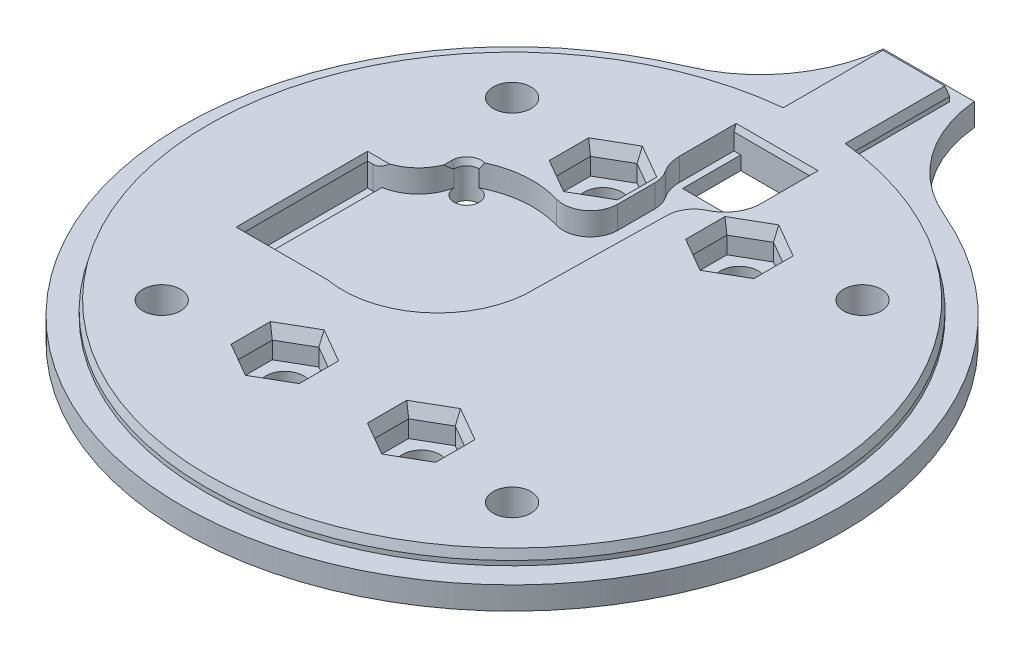
from build123d import *
from OCP.BRepFilletAPI import BRepFilletAPI_MakeChamfer

# Parameters (mm, degrees)
SKETCH_1_R               = 72.5
EXTRUDE_1_DEPTH          = 5
SKETCH_2_R               = 67.35
EXTRUDE_2_DEPTH          = 3
SKETCH_3_W               = 50
SKETCH_3_H               = 50
EXTRUDE_3_DEPTH          = 25
SKETCH_5_R               = 4.15
CUT_EXTRUDE_2_DEPTH      = 106.534354596
SKETCH_6_R               = 2.75
CUT_EXTRUDE_3_DEPTH      = 108.710259493
SKETCH2_W                = 20.25
SKETCH2_H                = 10.35
CUT_EXTRUDE1_DEPTH       = 125.046362301
CHAMFER1_SIZE            = 2
CHAMFER1_SIZE2           = 0.535898385
SKETCH4_W                = 50
SKETCH4_H                = 50
CUT_EXTRUDE3_DEPTH       = 12.5
BOSS_EXTRUDE2_START      = -2
SKETCH5_W                = 50
SKETCH5_H                = 90
BOSS_EXTRUDE2_DEPTH      = 5.325
SKETCH6_R                = 4.15
CUT_EXTRUDE4_DEPTH       = 104.392725203
CUT_EXTRUDE5_DEPTH       = 6.5
CHAMFER2_SIZE            = 1
CHAMFER2_SIZE2           = 2.747477419
SKETCH8_W                = 17.5
SKETCH8_H                = 27.9
CUT_EXTRUDE6_DEPTH       = 5
CHAMFER3_SIZE            = 10
CHAMFER6_SIZE            = 3
CHAMFER6_SIZE2           = 5.795554958
CUT_EXTRUDE8_DEPTH       = 5
CHAMFER7_SIZE            = 0.5
CHAMFER7_SIZE2           = 1.37373871
SKETCH11_W               = 3
SKETCH11_H               = 27.9
CUT_EXTRUDE9_DEPTH       = 1.5
CHAMFER8_SIZE            = 1
SKETCH12_W               = 5.356236397
SKETCH12_H               = 35
BOSS_EXTRUDE3_DEPTH      = 5
SKETCH13_W               = 20
SKETCH13_H               = 40
BOSS_EXTRUDE5_DEPTH      = 5
FILLET2_R                = 30
BOSS_EXTRUDE6_START      = -3
SKETCH14_W               = 14.7
SKETCH14_H               = 22.5
BOSS_EXTRUDE6_DEPTH      = 3
CHAMFER9_SIZE            = 2
CHAMFER9_SIZE2           = 0.535898385
CUT_EXTRUDE11_DEPTH      = 118.890014844
CUT_EXTRUDE11_DEPTH_BACK = 118.890014844
SKETCH16_W               = 15
SKETCH16_H               = 12.8
CUT_EXTRUDE12_DEPTH      = 5
CUT_EXTRUDE13_DEPTH      = 5
FILLET4_R                = 6
CHAMFER10_SIZE           = 0.5
CHAMFER10_SIZE2          = 1.37373871
BOSS_EXTRUDE8_DEPTH      = 1
FILLET5_R                = 10


with BuildPart() as part:
    # Эскиз1 → Бобышка-Вытянуть1 (new body)
    with BuildSketch(Plane(origin=(0, 0, 0), x_dir=(1, 0, 0), z_dir=(0, 1, 0))):
        with Locations(Location((0, 0, 0), (0, 0, 270))):
            Circle(SKETCH_1_R)
    extrude(amount=EXTRUDE_1_DEPTH)

    # Эскиз2 → Бобышка-Вытянуть2 (add)
    with BuildSketch(Plane(origin=(0, 5, 0), x_dir=(1, 0, 0), z_dir=(0, 1, 0))):
        with Locations(Location((0, 0, 0), (0, 0, 270))):
            Circle(SKETCH_2_R)
    extrude(amount=EXTRUDE_2_DEPTH)

    # Эскиз3 → Бобышка-Вытянуть3 (add)
    with BuildSketch(Plane.XZ):
        Rectangle(SKETCH_3_W, SKETCH_3_H)
    extrude(amount=EXTRUDE_3_DEPTH)

    # Эскиз5 → Вырез-Вытянуть2 (cut, through all)
    with BuildSketch(Plane.XZ):
        with Locations(Location((38.537319575, -38.537319575, 0), (0, 0, 270))):
            Circle(SKETCH_5_R)
        with Locations(Location((-38.537319575, -38.537319575, 0), (0, 0, 270))):
            Circle(SKETCH_5_R)
        with Locations(Location((-38.537319575, 38.537319575, 0), (0, 0, 270))):
            Circle(SKETCH_5_R)
        with Locations(Location((38.537319575, 38.537319575, 0), (0, 0, 270))):
            Circle(SKETCH_5_R)
    extrude(amount=-CUT_EXTRUDE_2_DEPTH, mode=Mode.SUBTRACT)

    # Эскиз6 → Вырез-Вытянуть3 (cut, through all)
    with BuildSketch(Plane(origin=(0, 8, 0), x_dir=(1, 0, 0), z_dir=(0, 1, 0))):
        with Locations(Location((-30, 20, 0), (0, 0, 270))):
            Circle(SKETCH_6_R)
    extrude(amount=-CUT_EXTRUDE_3_DEPTH, mode=Mode.SUBTRACT)

    # Sketch2 → Cut-Extrude1 (cut, through all)
    with BuildSketch(Plane.ZY.offset(25)):
        with Locations((0, -12.5)):
            Rectangle(SKETCH2_W, SKETCH2_H)
    extrude(amount=-CUT_EXTRUDE1_DEPTH, mode=Mode.SUBTRACT)

    # Chamfer1
    chamfer1_edges = [part.edges().sort_by_distance(p)[0] for p in [
        (0, 8, -67.35),
    ]]
    chamfer1_side = [part.faces().sort_by_distance(p)[0] for p in [
        (0, 6.5, -67.35),
    ]]
    chamfer(chamfer1_edges, length=CHAMFER1_SIZE, length2=CHAMFER1_SIZE2, reference=chamfer1_side[0])

    # Sketch4 → Cut-Extrude3 (cut)
    with BuildSketch(Plane.XZ.offset(25)):
        Rectangle(SKETCH4_W, SKETCH4_H)
    extrude(amount=-CUT_EXTRUDE3_DEPTH, mode=Mode.SUBTRACT)

    # Sketch5 → Boss-Extrude2 (add)
    with BuildSketch(Plane.XZ.offset(7.325).offset(BOSS_EXTRUDE2_START)):
        Rectangle(SKETCH5_W, SKETCH5_H)
    extrude(amount=-BOSS_EXTRUDE2_DEPTH)

    # Sketch6 → Cut-Extrude4 (cut, through all)
    with BuildSketch(Plane.XZ.offset(5.325)):
        with Locations(Location((-15, 35, 0), (0, 0, 270))):
            Circle(SKETCH6_R)
        with Locations(Location((-15, -35, 0), (0, 0, 270))):
            Circle(SKETCH6_R)
        with Locations(Location((15, 35, 0), (0, 0, 270))):
            Circle(SKETCH6_R)
        with Locations(Location((15, -35, 0), (0, 0, 270))):
            Circle(SKETCH6_R)
    extrude(amount=-CUT_EXTRUDE4_DEPTH, mode=Mode.SUBTRACT)

    # Sketch7 → Cut-Extrude5 (cut)
    with BuildSketch(Plane(origin=(0, 8, 0), x_dir=(1, 0, 0), z_dir=(0, 1, 0))):
        Polygon((-15, -42.5), (-8.504809472, -38.75), (-8.504809472, -31.25), (-15, -27.5), (-21.495190528, -31.25), (-21.495190528, -38.75), align=None)
        Polygon((-15, 27.5), (-8.504809472, 31.25), (-8.504809472, 38.75), (-15, 42.5), (-21.495190528, 38.75), (-21.495190528, 31.25), align=None)
        Polygon((15, -42.5), (21.495190528, -38.75), (21.495190528, -31.25), (15, -27.5), (8.504809472, -31.25), (8.504809472, -38.75), align=None)
        Polygon((15, 27.5), (21.495190528, 31.25), (21.495190528, 38.75), (15, 42.5), (8.504809472, 38.75), (8.504809472, 31.25), align=None)
    extrude(amount=-CUT_EXTRUDE5_DEPTH, mode=Mode.SUBTRACT)

    # Chamfer2
    chamfer2_edges = [part.edges().sort_by_distance(p)[0] for p in [
        (-18.247595264, 8, 40.625),
        (-11.752404736, 8, 40.625),
        (-8.504809472, 8, 35),
        (-11.752404736, 8, 29.375),
        (-18.247595264, 8, 29.375),
        (-21.495190528, 8, 35),
        (-18.247595264, 8, -29.375),
        (-11.752404736, 8, -29.375),
        (-8.504809472, 8, -35),
        (-11.752404736, 8, -40.625),
        (-18.247595264, 8, -40.625),
        (-21.495190528, 8, -35),
        (11.752404736, 8, 40.625),
        (18.247595264, 8, 40.625),
        (21.495190528, 8, 35),
        (18.247595264, 8, 29.375),
        (11.752404736, 8, 29.375),
        (8.504809472, 8, 35),
        (11.752404736, 8, -29.375),
        (18.247595264, 8, -29.375),
        (21.495190528, 8, -35),
        (18.247595264, 8, -40.625),
        (11.752404736, 8, -40.625),
        (8.504809472, 8, -35),
    ]]
    chamfer2_side = [part.faces().sort_by_distance(p)[0] for p in [
        (0.05399731, 8, 0.035998207),
    ]]
    chamfer(chamfer2_edges, length=CHAMFER2_SIZE, length2=CHAMFER2_SIZE2, reference=chamfer2_side[0])

    # Sketch8 → Cut-Extrude6 (cut)
    with BuildSketch(Plane(origin=(0, 8, 0), x_dir=(1, 0, 0), z_dir=(0, 1, 0))):
        with Locations((-35, -2)):
            Rectangle(SKETCH8_W, SKETCH8_H)
    extrude(amount=-CUT_EXTRUDE6_DEPTH, mode=Mode.SUBTRACT)

    # Chamfer3
    chamfer3_edges = [part.edges().sort_by_distance(p)[0] for p in [
        (25, -2.6625, -45),
        (-25, -2.6625, 45),
        (25, -2.6625, 45),
        (-25, -2.6625, -45),
    ]]
    chamfer(chamfer3_edges, length=CHAMFER3_SIZE)

    # Chamfer6: one chamfer whose edges measure the first distance from different faces: ONE call of the kernel's chamfer builder (chamfer() names one face for all edges)
    chamfer6_edges_1 = [part.edges().sort_by_distance(p)[0] for p in [
        (25, -2.6625, -35),
    ]]
    chamfer6_side_1 = [part.faces().sort_by_distance(p)[0] for p in [
        (20, -2.6625, -40),
    ]]
    chamfer6_edges_2 = [part.edges().sort_by_distance(p)[0] for p in [
        (25, -2.6625, 35),
    ]]
    chamfer6_side_2 = [part.faces().sort_by_distance(p)[0] for p in [
        (20, -2.6625, 40),
    ]]
    chamfer6_edges_3 = [part.edges().sort_by_distance(p)[0] for p in [
        (-25, -2.6625, 35),
    ]]
    chamfer6_side_3 = [part.faces().sort_by_distance(p)[0] for p in [
        (-20, -2.6625, 40),
    ]]
    chamfer6_edges_4 = [part.edges().sort_by_distance(p)[0] for p in [
        (-25, -2.6625, -35),
    ]]
    chamfer6_side_4 = [part.faces().sort_by_distance(p)[0] for p in [
        (-20, -2.6625, -40),
    ]]
    chamfer6 = BRepFilletAPI_MakeChamfer(part.part.solid().wrapped)
    for e in chamfer6_edges_1:
        chamfer6.Add(CHAMFER6_SIZE, CHAMFER6_SIZE2, e.wrapped, chamfer6_side_1[0].wrapped)  # the first distance lies on this face
    for e in chamfer6_edges_2:
        chamfer6.Add(CHAMFER6_SIZE, CHAMFER6_SIZE2, e.wrapped, chamfer6_side_2[0].wrapped)  # the first distance lies on this face
    for e in chamfer6_edges_3:
        chamfer6.Add(CHAMFER6_SIZE, CHAMFER6_SIZE2, e.wrapped, chamfer6_side_3[0].wrapped)  # the first distance lies on this face
    for e in chamfer6_edges_4:
        chamfer6.Add(CHAMFER6_SIZE, CHAMFER6_SIZE2, e.wrapped, chamfer6_side_4[0].wrapped)  # the first distance lies on this face
    add(Compound.cast(chamfer6.Shape()), mode=Mode.REPLACE)

    # Sketch10 → Cut-Extrude8 (cut)
    with BuildSketch(Plane(origin=(0, 8, 0), x_dir=(1, 0, 0), z_dir=(0, 1, 0))):
        with BuildLine():
            Line((-32.75, 20), (-32.75, 11.95))
            Line((-32.75, 11.95), (-26.25, 11.95))
            Line((-26.25, 11.95), (-26.25, -15.95))
            ThreePointArc((-26.25, -15.95), (0.316727959, 6.155981391), (-30, 22.75))
            ThreePointArc((-30, 22.75), (-31.944543648, 21.944543648), (-32.75, 20))
        make_face()
    extrude(amount=-CUT_EXTRUDE8_DEPTH, mode=Mode.SUBTRACT)

    # Chamfer7
    chamfer7_edges = [part.edges().sort_by_distance(p)[0] for p in [
        (-43.75, 8, 2),
        (-35, 8, 15.95),
        (-38.25, 8, -11.95),
        (-32.75, 8, -15.975),
        (-31.944543648, 8, -21.944543648),
    ]]
    chamfer7_side = [part.faces().sort_by_distance(p)[0] for p in [
        (2.833522961, 8, 0.355265211),
    ]]
    chamfer(chamfer7_edges, length=CHAMFER7_SIZE, length2=CHAMFER7_SIZE2, reference=chamfer7_side[0])

    # Sketch11 → Cut-Extrude9 (cut)
    with BuildSketch(Plane(origin=(0, 3, 0), x_dir=(1, 0, 0), z_dir=(0, 1, 0))):
        with Locations((-42.25, -2)):
            Rectangle(SKETCH11_W, SKETCH11_H)
    extrude(amount=-CUT_EXTRUDE9_DEPTH, mode=Mode.SUBTRACT)

    # Chamfer8
    chamfer8_edges = [part.edges().sort_by_distance(p)[0] for p in [
        (0, -12.5, 10.125),
        (0, -12.5, -10.125),
    ]]
    chamfer(chamfer8_edges, length=CHAMFER8_SIZE)

    # Sketch12 → Boss-Extrude3 (add)
    with BuildSketch(Plane.XZ):
        with Locations((-67.678118199, 0)):
            Rectangle(SKETCH12_W, SKETCH12_H)
    extrude(amount=-BOSS_EXTRUDE3_DEPTH)

    # Sketch13 → Boss-Extrude5 (add)
    with BuildSketch(Plane.XZ):
        with Locations((0, -71.66)):
            Rectangle(SKETCH13_W, SKETCH13_H)
    extrude(amount=-BOSS_EXTRUDE5_DEPTH)

    # Fillet2
    # the kernel refuses this fillet: 30 mm, written as the material it adds along each edge
    with BuildSketch(Plane(origin=(-10, 5, -71.807033082), x_dir=(0, 0, -1), z_dir=(0, -1, 0))) as fillet2_piece_1:
        with BuildLine():
            CenterArc((22.619997266, -29.872119829), FILLET2_R, 95.292160412, 61.815779483)
            Line((-5.017182348, -18.202231098), (-5.56992594, -17.968833324))
            ThreePointArc((-5.56992594, -17.968833324), (-2.491940672, -9.10570502), (-0.594265101, 0.082758621))
            Line((-0.594265101, 0.082758621), (0, 0.6))
            ThreePointArc((0, 0.6), (9.926483459, 0.6), (19.797626311, 0.597442397))
            Line((19.797626311, 0.597442397), (19.852966918, 0))
        make_face()
    extrude(amount=5)
    with BuildSketch(Plane(origin=(10, 5, -71.807033082), x_dir=(0, 0, -1), z_dir=(0, -1, 0))) as fillet2_piece_2:
        with BuildLine():
            CenterArc((22.619997266, 29.872119829), FILLET2_R, 202.892060105, 61.815779483)
            Line((-5.017182348, 18.202231098), (-5.56992594, 17.968833324))
            ThreePointArc((-5.56992594, 17.968833324), (-2.491940672, 9.10570502), (-0.594265101, -0.082758621))
            Line((-0.594265101, -0.082758621), (0, -0.6))
            ThreePointArc((0, -0.6), (9.926483459, -0.6), (19.797626311, -0.597442397))
            Line((19.797626311, -0.597442397), (19.852966918, 0))
        make_face()
    extrude(amount=5)

    # Sketch14 → Boss-Extrude6 (add)
    with BuildSketch(Plane(origin=(0, 8, 0), x_dir=(1, 0, 0), z_dir=(0, 1, 0)).offset(BOSS_EXTRUDE6_START)):
        with Locations((0, 77.658596391)):
            Rectangle(SKETCH14_W, SKETCH14_H)
    extrude(amount=BOSS_EXTRUDE6_DEPTH)

    # Chamfer9: one chamfer whose edges measure the first distance from different faces: ONE call of the kernel's chamfer builder (chamfer() names one face for all edges)
    chamfer9_edges_1 = [part.edges().sort_by_distance(p)[0] for p in [
        (-7.35, 8, -77.658596391),
    ]]
    chamfer9_side_1 = [part.faces().sort_by_distance(p)[0] for p in [
        (-7.35, 6.506764094, -77.837583292),
    ]]
    chamfer9_edges_2 = [part.edges().sort_by_distance(p)[0] for p in [
        (0, 8, -88.908596391),
    ]]
    chamfer9_side_2 = [part.faces().sort_by_distance(p)[0] for p in [
        (0, 6.5, -88.908596391),
    ]]
    chamfer9_edges_3 = [part.edges().sort_by_distance(p)[0] for p in [
        (7.35, 8, -77.658596391),
    ]]
    chamfer9_side_3 = [part.faces().sort_by_distance(p)[0] for p in [
        (7.35, 6.506764094, -77.837583292),
    ]]
    chamfer9 = BRepFilletAPI_MakeChamfer(part.part.solid().wrapped)
    for e in chamfer9_edges_1:
        chamfer9.Add(CHAMFER9_SIZE, CHAMFER9_SIZE2, e.wrapped, chamfer9_side_1[0].wrapped)  # the first distance lies on this face
    for e in chamfer9_edges_2:
        chamfer9.Add(CHAMFER9_SIZE, CHAMFER9_SIZE2, e.wrapped, chamfer9_side_2[0].wrapped)  # the first distance lies on this face
    for e in chamfer9_edges_3:
        chamfer9.Add(CHAMFER9_SIZE, CHAMFER9_SIZE2, e.wrapped, chamfer9_side_3[0].wrapped)  # the first distance lies on this face
    add(Compound.cast(chamfer9.Shape()), mode=Mode.REPLACE)

    # Sketch16 → Cut-Extrude11 (cut, two sides: drawn at the far end of the back side and taken through both)
    with BuildSketch(Plane(origin=(0, 3, 0), x_dir=(1, 0, 0), z_dir=(0, 1, 0)).offset(-CUT_EXTRUDE11_DEPTH_BACK)):
        with Locations((0, 51.4)):
            Rectangle(SKETCH16_W, SKETCH16_H)
    extrude(amount=CUT_EXTRUDE11_DEPTH + CUT_EXTRUDE11_DEPTH_BACK, mode=Mode.SUBTRACT)

    # Sketch19 → Cut-Extrude12 (cut)
    with BuildSketch(Plane(origin=(0, 8, 0), x_dir=(1, 0, 0), z_dir=(0, 1, 0))):
        with BuildLine():
            Line((-1, 37.8), (1, 37.8))
            ThreePointArc((1, 37.8), (6.656854249, 40.143145751), (9, 45.8))
            Line((9, 45.8), (9, 57.8))
            Line((9, 57.8), (-9, 57.8))
            Line((-9, 57.8), (-9, 45.8))
            ThreePointArc((-9, 45.8), (-6.656854249, 40.143145751), (-1, 37.8))
        make_face()
    extrude(amount=-CUT_EXTRUDE12_DEPTH, mode=Mode.SUBTRACT)

    # Sketch20 → Cut-Extrude13 (cut)
    with BuildSketch(Plane(origin=(0, 8, 0), x_dir=(1, 0, 0), z_dir=(0, 1, 0))):
        with BuildLine():
            Line((1, 37.8), (0.344510352, 2.435242953))
            Line((0.344510352, 2.435242953), (-6.656854249, 19.811083442))
            Line((-6.656854249, 19.811083442), (-6.656854249, 40.143145751))
            ThreePointArc((-6.656854249, 40.143145751), (-4.061467459, 38.40896374), (-1, 37.8))
            Line((-1, 37.8), (1, 37.8))
        make_face()
    extrude(amount=-CUT_EXTRUDE13_DEPTH, mode=Mode.SUBTRACT)

    # Fillet4
    fillet4_edges = [part.edges().sort_by_distance(p)[0] for p in [
        (1, 5.5, -37.8),
        (-6.656854249, 5.5, -40.143145751),
        (-6.656854249, 5.5, -19.811083442),
    ]]
    fillet(fillet4_edges, radius=FILLET4_R)

    # Chamfer10
    chamfer10_edges = [part.edges().sort_by_distance(p)[0] for p in [
        (0, 8, -57.8),
    ]]
    chamfer10_side = [part.faces().sort_by_distance(p)[0] for p in [
        (3.079405642, 8, 0.226505842),
    ]]
    chamfer(chamfer10_edges, length=CHAMFER10_SIZE, length2=CHAMFER10_SIZE2, reference=chamfer10_side[0])

    # Sketch21 → Boss-Extrude8 (add)
    # profile 1 of 4: a face of its own
    with BuildSketch(Plane.XZ):
        Polygon((-12.512820513, -76.708839129), (-12.512820513, -68.708839129), (-7.692307692, -68.708839129), (-7.692307692, -70.042172462), (-11.179487179, -70.042172462), (-11.179487179, -71.990890411), (-8.102564103, -71.990890411), (-8.102564103, -73.324223744), (-11.179487179, -73.324223744), (-11.179487179, -76.708839129), align=None)
    # profile 2 of 4: a face of its own
    with BuildSketch(Plane.XZ):
        Polygon((-4.923076923, -76.708839129), (-4.923076923, -70.042172462), (-6.974358974, -70.042172462), (-6.974358974, -68.708839129), (-1.538461538, -68.708839129), (-1.538461538, -70.042172462), (-3.58974359, -70.042172462), (-3.58974359, -76.708839129), align=None)
    # profile 3 of 4: a face of its own
    with BuildSketch(Plane.XZ):
        with BuildLine():
            Line((4.102564103, -73.734480154), (5.435897436, -74.247300667))
            add(Edge.make_bspline(
                [(5.435897436, -74.247300667), (5.408074392, -74.348024588), (5.353755481, -74.544667831), (5.25684294, -74.828358281), (5.142232503, -75.090341897), (5.018406045, -75.334433006), (4.877534172, -75.555576438), (4.727264768, -75.760193346), (4.560220368, -75.942187916), (4.381251214, -76.105458575), (4.190178325, -76.249160829), (3.984678294, -76.370870373), (3.76791254, -76.476018879), (3.537718535, -76.559936175), (3.296520878, -76.628785424), (3.041898976, -76.673491901), (2.775835309, -76.703727939), (2.594105563, -76.707115044), (2.501602564, -76.708839129)],
                knots=[0, 0, 0, 0, 1.198775336, 2.340368289, 3.435616053, 4.477217326, 5.477015256, 6.440443256, 7.386164735, 8.305912611, 9.216631866, 10.123693807, 11.041970346, 11.976625703, 12.931280842, 13.915784304, 14.939104867, 16, 16, 16, 16], degree=3))
            add(Edge.make_bspline(
                [(2.501602564, -76.708839129), (2.386531309, -76.706235104), (2.161060395, -76.701132772), (1.830941817, -76.646880432), (1.516365503, -76.564757279), (1.21634082, -76.448492937), (0.933783164, -76.297136996), (0.666926154, -76.111753508), (0.41457155, -75.895228272), (0.181437656, -75.644913899), (-0.030350938, -75.366199072), (-0.214600897, -75.06084225), (-0.370863125, -74.731071138), (-0.498963432, -74.377473323), (-0.598266801, -73.998740372), (-0.667661004, -73.596093227), (-0.709854522, -73.169141577), (-0.715202226, -72.876673906), (-0.717948718, -72.726467334)],
                knots=[0, 0, 0, 0, 0.959362395, 1.879777157, 2.783637912, 3.668494084, 4.557863058, 5.451788729, 6.374725563, 7.327093754, 8.300589743, 9.290528948, 10.297382912, 11.340817566, 12.42413264, 13.559982916, 14.746847464, 16, 16, 16, 16], degree=3))
            add(Edge.make_bspline(
                [(-0.717948718, -72.726467334), (-0.715148897, -72.56826137), (-0.709690431, -72.259826736), (-0.668290084, -71.810899986), (-0.597613547, -71.388931272), (-0.501443123, -70.993761698), (-0.374207592, -70.626488786), (-0.220225986, -70.2857034), (-0.037531891, -69.972246116), (0.172773964, -69.68754476), (0.40721535, -69.434681206), (0.658678605, -69.212105801), (0.928959356, -69.023926624), (1.217533816, -68.871065934), (1.524136379, -68.751910208), (1.848201465, -68.666705607), (2.190220162, -68.616746106), (2.423980416, -68.609813012), (2.543269231, -68.606275026)],
                knots=[0, 0, 0, 0, 1.28229292, 2.499928197, 3.650293311, 4.747750281, 5.792589881, 6.796353809, 7.774422504, 8.727923098, 9.659441741, 10.564550584, 11.445003982, 12.322481659, 13.205391236, 14.105483459, 15.033220446, 16, 16, 16, 16], degree=3))
            add(Edge.make_bspline(
                [(2.543269231, -68.606275026), (2.647551643, -68.60922609), (2.85156175, -68.614999324), (3.150399367, -68.654941874), (3.433437506, -68.724835919), (3.70305449, -68.818330081), (3.95628746, -68.943334455), (4.194529076, -69.095108854), (4.419443923, -69.272749177), (4.552800786, -69.411272598), (4.620192308, -69.481275026)],
                knots=[0, 0, 0, 0, 1.077018231, 2.106995795, 3.106601534, 4.083801927, 5.048587746, 6.015925872, 6.997353628, 8, 8, 8, 8], degree=3))
            add(Edge.make_bspline(
                [(4.620192308, -69.481275026), (4.659512671, -69.525997207), (4.739578825, -69.617062821), (4.845633579, -69.7692612), (4.947501149, -69.932807434), (5.040703423, -70.111734641), (5.124434954, -70.305727572), (5.20319985, -70.51243124), (5.274480937, -70.733197871), (5.313357147, -70.886484467), (5.333333333, -70.965249385)],
                knots=[0, 0, 0, 0, 0.858519553, 1.748161818, 2.672126799, 3.637341794, 4.655416187, 5.718917618, 6.827886643, 8, 8, 8, 8], degree=3))
            Line((5.333333333, -70.965249385), (4, -71.272941693))
            add(Edge.make_bspline(
                [(4, -71.272941693), (3.988536097, -71.222505705), (3.965983505, -71.123284498), (3.918602017, -70.980643808), (3.864661453, -70.84596457), (3.801658923, -70.719008114), (3.728330141, -70.601193203), (3.645317845, -70.491608123), (3.556423801, -70.38817811), (3.456606656, -70.295934253), (3.350576496, -70.212233291), (3.23905584, -70.138311575), (3.120774625, -70.076774651), (2.996883672, -70.02788269), (2.868794878, -69.986495933), (2.73421692, -69.960582628), (2.594575785, -69.941286986), (2.499003886, -69.940174864), (2.450320513, -69.939608359)],
                knots=[0, 0, 0, 0, 1.113413563, 2.190385138, 3.233007624, 4.236357095, 5.238848635, 6.216809649, 7.195244301, 8.172054095, 9.138783586, 10.102495896, 11.049371996, 12.00439147, 12.968721699, 13.943496612, 14.952437649, 16, 16, 16, 16], degree=3))
            add(Edge.make_bspline(
                [(2.450320513, -69.939608359), (2.38394839, -69.941222592), (2.253149041, -69.944403755), (2.062640513, -69.97641251), (1.880607683, -70.02399195), (1.708344189, -70.092622109), (1.547558299, -70.184642405), (1.393459928, -70.291122974), (1.252737939, -70.422101553), (1.117907912, -70.568657445), (0.999229839, -70.740970638), (0.894313134, -70.935574002), (0.808880432, -71.156283555), (0.736604083, -71.399418611), (0.68346245, -71.667848257), (0.64350872, -71.959976136), (0.619663508, -72.276820972), (0.616841816, -72.496191209), (0.615384615, -72.609480154)],
                knots=[0, 0, 0, 0, 0.86933471, 1.713195361, 2.525131312, 3.332646472, 4.13522787, 4.949274865, 5.782080478, 6.649749605, 7.555006275, 8.516834317, 9.54150931, 10.651565909, 11.838124649, 13.124560025, 14.515042121, 16, 16, 16, 16], degree=3))
            add(Edge.make_bspline(
                [(0.615384615, -72.609480154), (0.616822068, -72.729711082), (0.619591487, -72.961349961), (0.643428979, -73.295275583), (0.683665816, -73.602279745), (0.736007357, -73.883661974), (0.808809073, -74.137361979), (0.893686958, -74.365737523), (0.998768135, -74.565790984), (1.117742299, -74.740571983), (1.250460353, -74.891036928), (1.393960613, -75.019311939), (1.545730485, -75.130217192), (1.70781137, -75.219961648), (1.879591925, -75.289509984), (2.060793704, -75.339142089), (2.251574175, -75.370588561), (2.382355149, -75.373850549), (2.448717949, -75.375505795)],
                knots=[0, 0, 0, 0, 1.538114971, 2.963357539, 4.279858391, 5.49823865, 6.62101297, 7.65291371, 8.609751213, 9.504506932, 10.35188728, 11.169760046, 11.962665863, 12.751940505, 13.533722993, 14.327953142, 15.151545466, 16, 16, 16, 16], degree=3))
            add(Edge.make_bspline(
                [(2.448717949, -75.375505795), (2.497900006, -75.374107278), (2.594977131, -75.371346839), (2.738055026, -75.354486519), (2.875025585, -75.321344189), (3.00688856, -75.277999162), (3.134888968, -75.223858183), (3.256035978, -75.154318007), (3.372580853, -75.073586525), (3.483337742, -74.980470611), (3.58806444, -74.873832671), (3.686321721, -74.753872352), (3.774019482, -74.617446758), (3.855790066, -74.468735756), (3.929574853, -74.305105424), (3.996806022, -74.128223136), (4.054148396, -73.936141093), (4.086109036, -73.803018744), (4.102564103, -73.734480154)],
                knots=[0, 0, 0, 0, 0.927683701, 1.831091914, 2.710766255, 3.580462431, 4.446885106, 5.326559447, 6.20963056, 7.117688761, 8.050880641, 9.024781813, 10.036253679, 11.104762868, 12.222795478, 13.41838039, 14.670842521, 16, 16, 16, 16], degree=3))
        make_face()
    # profile 4 of 4: a face of its own
    with BuildSketch(Plane.XZ):
        with BuildLine():
            Line((6.666666667, -76.708839129), (6.666666667, -68.708839129))
            Line((6.666666667, -68.708839129), (9.650641026, -68.708839129))
            add(Edge.make_bspline(
                [(9.650641026, -68.708839129), (9.741457285, -68.709464805), (9.916200448, -68.710668694), (10.169085363, -68.719529197), (10.402479385, -68.738131179), (10.617175645, -68.758760703), (10.812236392, -68.789890256), (10.987958413, -68.825670813), (11.144888494, -68.868998112), (11.284865141, -68.919006625), (11.412465291, -68.977166349), (11.530420644, -69.047441119), (11.642363353, -69.126824702), (11.746939957, -69.218065521), (11.847036823, -69.31728755), (11.939744962, -69.427832659), (12.024983671, -69.549612538), (12.131642651, -69.724258848), (12.244452641, -69.96057614), (12.340786419, -70.26518319), (12.399750327, -70.589039723), (12.406709048, -70.811686276), (12.41025641, -70.925185282)],
                knots=[0, 0, 0, 0, 1.332233717, 2.563403683, 3.710720742, 4.766477057, 5.72626663, 6.606881325, 7.395882391, 8.112234672, 8.785412227, 9.449312999, 10.123402102, 10.795712543, 11.482793851, 12.189132762, 12.908777651, 13.661372244, 15.189557583, 16.73595717, 18.336081952, 20, 20, 20, 20], degree=3))
            add(Edge.make_bspline(
                [(12.41025641, -70.925185282), (12.409262467, -70.997895522), (12.407321374, -71.139892921), (12.385196919, -71.348077192), (12.352623147, -71.547050239), (12.304455754, -71.73618551), (12.242829986, -71.915469995), (12.170166829, -72.085791074), (12.080548995, -72.245647442), (11.978942076, -72.39591614), (11.862967752, -72.534483492), (11.734001108, -72.659943286), (11.592528073, -72.773411542), (11.435750336, -72.870546233), (11.266815034, -72.956648049), (11.08315473, -73.026048126), (10.887189298, -73.084557037), (10.750799671, -73.111655523), (10.681089744, -73.125505795)],
                knots=[0, 0, 0, 0, 1.131467161, 2.209666695, 3.255535815, 4.268042702, 5.243713689, 6.204636371, 7.146441174, 8.092129724, 9.02485899, 9.954022537, 10.889121395, 11.842022095, 12.820135404, 13.836323899, 14.894126284, 16, 16, 16, 16], degree=3))
            add(Edge.make_bspline(
                [(10.681089744, -73.125505795), (10.750237648, -73.177429933), (10.886278462, -73.279584903), (11.073769736, -73.446759237), (11.243247606, -73.621387092), (11.369571077, -73.778124716), (11.469486738, -73.913400474), (11.546877364, -74.034314494), (11.631944288, -74.172079133), (11.723040279, -74.327722182), (11.821069812, -74.501207535), (11.924909882, -74.692912395), (12.033608723, -74.90329545), (12.107492922, -75.049589862), (12.145833333, -75.125505795)],
                knots=[0, 0, 0, 0, 1.240563135, 2.440670042, 3.600961809, 4.728863836, 5.326893702, 6.013712479, 6.788172648, 7.650704472, 8.601618671, 9.647881323, 10.77942511, 12, 12, 12, 12], degree=3))
            Line((12.145833333, -75.125505795), (13.025641026, -76.708839129))
            Line((13.025641026, -76.708839129), (11.442307692, -76.708839129))
            Line((11.442307692, -76.708839129), (10.403846154, -74.88512118))
            add(Edge.make_bspline(
                [(10.403846154, -74.88512118), (10.355209249, -74.813023299), (10.262243873, -74.675214227), (10.130155003, -74.478538988), (10.009650723, -74.303156284), (9.900828052, -74.149171863), (9.803169187, -74.01605773), (9.717500115, -73.904068274), (9.642846438, -73.813992074), (9.564265792, -73.72071128), (9.468428287, -73.629174592), (9.353225071, -73.535968798), (9.232309902, -73.463444401), (9.10270385, -73.407466382), (8.95314565, -73.368702556), (8.773165399, -73.343403137), (8.557512465, -73.325470207), (8.401220122, -73.32465918), (8.317307692, -73.324223744)],
                knots=[0, 0, 0, 0, 1.49640503, 2.860253109, 4.07635657, 5.157653843, 6.104402623, 6.916988627, 7.583088608, 8.117450419, 9.014438673, 9.858488553, 10.662399199, 11.432386823, 12.279633495, 13.31176398, 14.556702077, 16, 16, 16, 16], degree=3))
            Line((8.317307692, -73.324223744), (8, -73.324223744))
            Line((8, -73.324223744), (8, -76.708839129))
            Line((8, -76.708839129), (6.666666667, -76.708839129))
        make_face()
        with BuildLine():
            Line((8, -71.990890411), (9.126602564, -71.990890411))
            add(Edge.make_bspline(
                [(9.126602564, -71.990890411), (9.213680344, -71.990688561), (9.379303265, -71.990304642), (9.614861026, -71.984626843), (9.824938822, -71.979862063), (10.008653076, -71.967781416), (10.166932695, -71.955751501), (10.299118154, -71.940404055), (10.406328635, -71.921799748), (10.513602459, -71.893309275), (10.623441819, -71.843152418), (10.740835457, -71.772706335), (10.839270357, -71.679558711), (10.926246322, -71.573865675), (10.992267803, -71.449104668), (11.043546607, -71.311023221), (11.071648658, -71.157613167), (11.075127317, -71.050824667), (11.076923077, -70.995698103)],
                knots=[0, 0, 0, 0, 1.65492276, 3.147681793, 4.478306581, 5.64802912, 6.646304298, 7.495073225, 8.17613767, 8.71308067, 9.599627897, 10.461652109, 11.302367555, 12.161757066, 13.052248647, 13.970830416, 14.952498184, 16, 16, 16, 16], degree=3))
            add(Edge.make_bspline(
                [(11.076923077, -70.995698103), (11.07469926, -70.934034803), (11.07041646, -70.8152788), (11.031246193, -70.647291474), (10.968681595, -70.496687598), (10.876940197, -70.367665826), (10.763964899, -70.257068814), (10.628100567, -70.169639939), (10.471579338, -70.104683649), (10.358425807, -70.080413768), (10.299679487, -70.067813488)],
                knots=[0, 0, 0, 0, 1.109009191, 2.135816575, 3.088275693, 4.02772233, 4.966577686, 5.919182548, 6.919694622, 8, 8, 8, 8], degree=3))
            add(Edge.make_bspline(
                [(10.299679487, -70.067813488), (10.280466974, -70.065465532), (10.234685925, -70.059870644), (10.153845675, -70.056367803), (10.049739578, -70.050786433), (9.922002492, -70.04865022), (9.771388658, -70.0446545), (9.597753273, -70.043949612), (9.401180356, -70.041642084), (9.26228735, -70.041989437), (9.189102564, -70.042172462)],
                knots=[0, 0, 0, 0, 0.417879204, 0.995754558, 1.746442203, 2.669671342, 3.754372176, 5.000395618, 6.41946394, 8, 8, 8, 8], degree=3))
            Line((9.189102564, -70.042172462), (8, -70.042172462))
            Line((8, -70.042172462), (8, -71.990890411))
        make_face(mode=Mode.SUBTRACT)
    extrude(amount=BOSS_EXTRUDE8_DEPTH)

    # Fillet5
    # the kernel refuses this fillet: 10 mm, written as the material it takes off along each edge
    with BuildSketch(Plane(origin=(-32.75, 48.310399086, -11.95), x_dir=(-1.0962659351724842e-12, 0, -1.0), z_dir=(0, -1, 0))) as fillet5_piece_1:
        with BuildLine():
            CenterArc((10, -9.808032422), FILLET5_R, 101.244723592, 78.755276408)
            Line((0, -9.808032422), (0, 0))
            Line((0, 0), (8.05, 0))
        make_face()
    extrude(amount=45.310399086, mode=Mode.SUBTRACT)
    with BuildSketch(Plane(origin=(-32.75, 48.310399086, -11.95), x_dir=(-1.0962659351724842e-12, 0, -1.0), z_dir=(0, -1, 0))) as fillet5_piece_2_section:
        with BuildLine():
            CenterArc((10, -9.808032422), FILLET5_R, 101.244723592, 78.755276408)
            Line((0, -9.808032422), (0, 0))
            Line((0, 0), (8.05, 0))
        make_face()
    fillet5_piece_2 = extrude(amount=69.830480142, mode=Mode.PRIVATE)
    fillet5_piece_2 = split(fillet5_piece_2, bisect_by=Plane(origin=(-40.75, 48.310399086, -11.95), z_dir=(-1, 0, 0)), keep=Keep.TOP, mode=Mode.PRIVATE)
    fillet5_piece_2 = split(fillet5_piece_2, bisect_by=Plane(origin=(-32.75, 1.5, -11.95), z_dir=(0, 1, 0)), keep=Keep.TOP, mode=Mode.PRIVATE)
    add(fillet5_piece_2, mode=Mode.SUBTRACT)


solid = part.part
